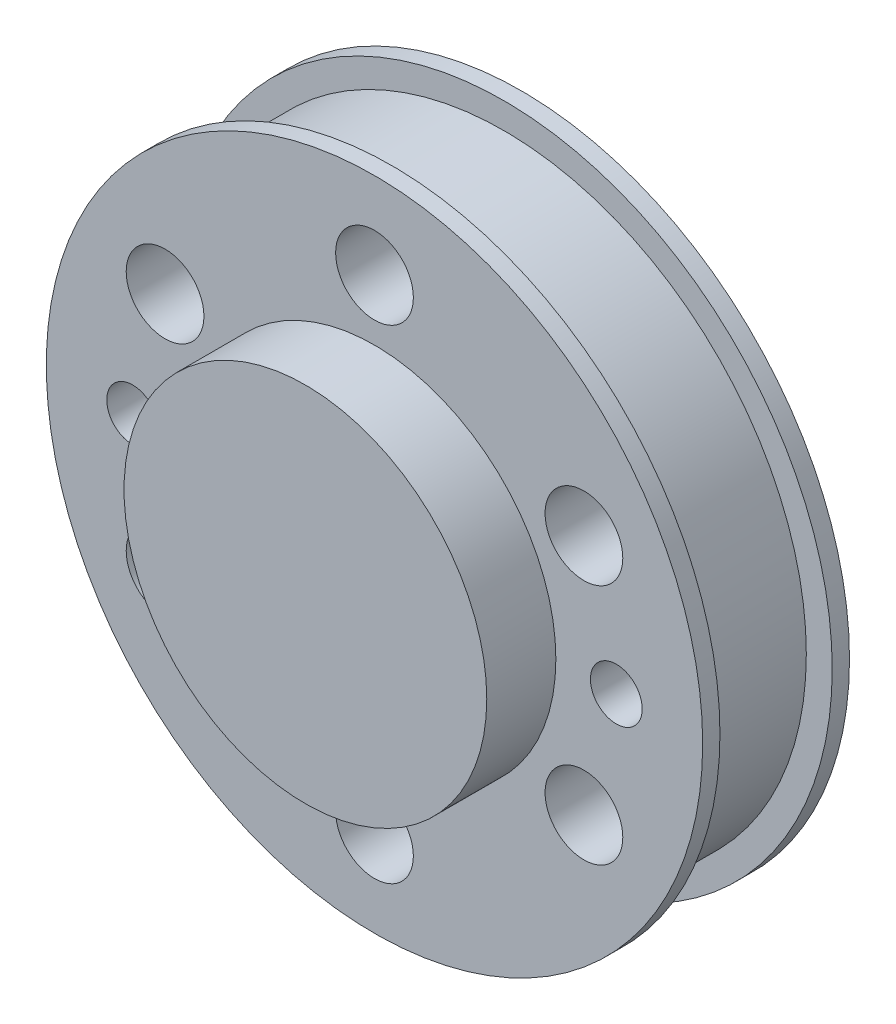
from build123d import *

# Parameters (mm, degrees)
M4_CLEARANCE_HOLE1_D  = 4.5
F_3_0MM_DOWEL_HOLE1_D = 3


with BuildPart() as part:
    # Sketch1 → Revolve1 (revolve)
    with BuildSketch(Plane(origin=(0, 0, 0), x_dir=(1, 0, 0), z_dir=(0, 1, 0))):
        Polygon((19, 8.5), (19, 7.5), (17.5, 7.5), (17.5, 1), (19, 1), (19, 0), (10.5, 0), (10.5, -4), (0, -4), (0, 8.5), align=None)
    revolve(axis=Axis((0, 0, 4), (0, 0, -1)))

    # M4 Clearance Hole1 (through all)
    with Locations(Plane(origin=(0, 0, -8.5), x_dir=(-1, 0, 0), z_dir=(0, 0, -1))):
        with Locations((-12.124355653, 7), (0, 14), (12.124355653, 7), (12.124355653, -7), (0, -14), (-12.124355653, -7)):
            Hole(M4_CLEARANCE_HOLE1_D / 2)

    # Ø3.0mm Dowel Hole1 (through all)
    with Locations(Plane(origin=(0, 0, -8.5), x_dir=(-1, 0, 0), z_dir=(0, 0, -1))):
        with Locations((14, 0), (-14, 0)):
            Hole(F_3_0MM_DOWEL_HOLE1_D / 2)


solid = part.part
